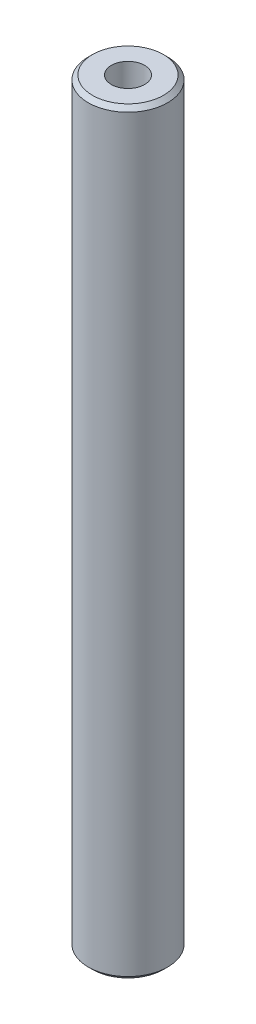
from build123d import *

# Parameters (mm, degrees)
SKETCH1_R           = 10
BOSS_EXTRUDE1_DEPTH = 190.707714155
SKETCH2_R           = 4.193235744
CUT_EXTRUDE1_DEPTH  = 192.231357884
CHAMFER1_SIZE       = 1.070310237


with BuildPart() as part:
    # Sketch1 → Boss-Extrude1 (new body)
    with BuildSketch(Plane(origin=(0, 0, 0), x_dir=(1, 0, 0), z_dir=(0, 1, 0))):
        Circle(SKETCH1_R)
    extrude(amount=BOSS_EXTRUDE1_DEPTH)

    # Sketch2 → Cut-Extrude1 (cut, through all)
    with BuildSketch(Plane(origin=(0, 0, 0), x_dir=(1, 0, 0), z_dir=(0, 1, 0))):
        Circle(SKETCH2_R)
    extrude(amount=CUT_EXTRUDE1_DEPTH, mode=Mode.SUBTRACT)

    # Chamfer1
    chamfer1_edges = [part.edges().sort_by_distance(p)[0] for p in [
        (-10, 190.707714155, 0),
        (-10, 0, 0),
    ]]
    chamfer(chamfer1_edges, length=CHAMFER1_SIZE)


solid = part.part
